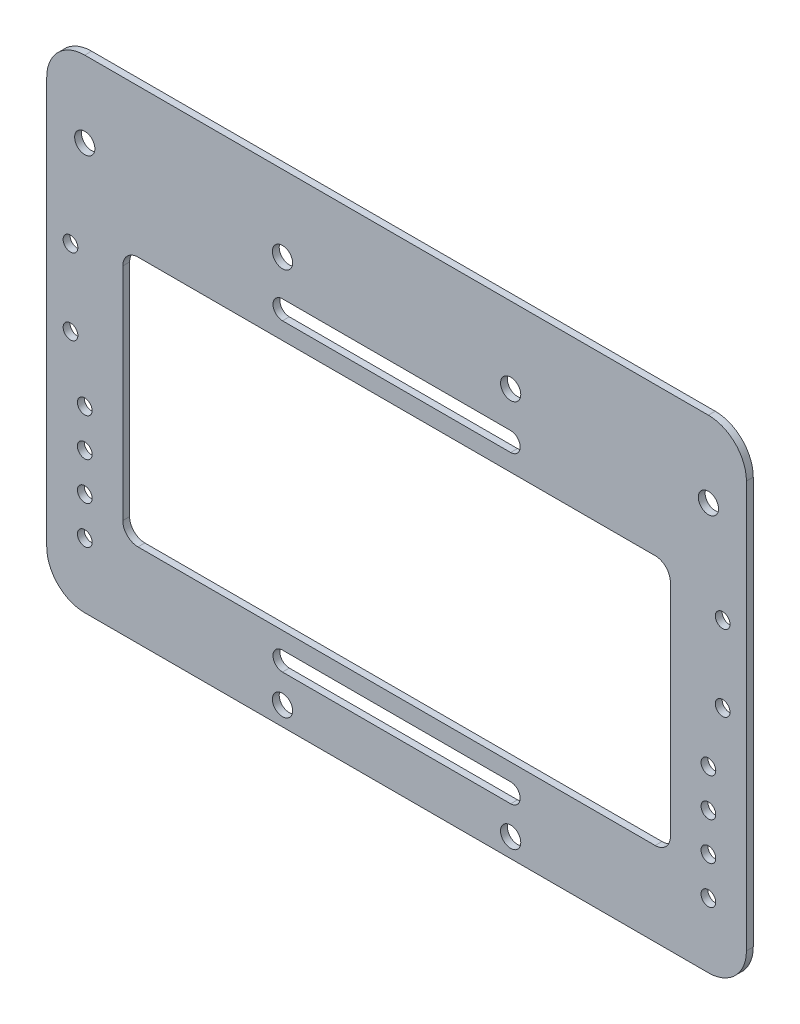
from build123d import *

# Parameters (mm, degrees)
SKETCH1_W                    = 233.68
SKETCH1_H                    = 161.29
BOSS_EXTRUDE1_DEPTH          = 2.286
CUT_EXTRUDE1_DEPTH           = 142.987419939
F_1_4_CLEARANCE_HOLE1_D      = 6.7564
F_1_4_CLEARANCE_HOLE2_D      = 6.7564
F_10_0_1935_DIAMETER_HOLE1_D = 4.9149
FILLET1_R                    = 12.7
F_10_0_1935_DIAMETER_HOLE2_D = 4.9149


with BuildPart() as part:
    # Sketch1 → Boss-Extrude1 (new body)
    with BuildSketch(Plane.XY):
        Rectangle(SKETCH1_W, SKETCH1_H)
        with BuildLine():
            Line((-86.36, 31.115), (86.36, 31.115))
            ThreePointArc((86.36, 31.115), (89.952102448, 29.627102448), (91.44, 26.035))
            Line((91.44, 26.035), (91.44, -47.625))
            ThreePointArc((91.44, -47.625), (89.952102448, -51.217102448), (86.36, -52.705))
            Line((86.36, -52.705), (-86.36, -52.705))
            ThreePointArc((-86.36, -52.705), (-89.952102448, -51.217102448), (-91.44, -47.625))
            Line((-91.44, -47.625), (-91.44, 26.035))
            ThreePointArc((-91.44, 26.035), (-89.952102448, 29.627102448), (-86.36, 31.115))
        make_face(mode=Mode.SUBTRACT)
    extrude(amount=BOSS_EXTRUDE1_DEPTH)

    # Sketch2 → Cut-Extrude1 (cut, through all)
    with BuildSketch(Plane.XY.offset(2.286)):
        with BuildLine():
            Line((38.1, 36.83), (-38.1, 36.83))
            ThreePointArc((-38.1, 36.83), (-41.275, 40.005), (-38.1, 43.18))
            Line((-38.1, 43.18), (38.1, 43.18))
            ThreePointArc((38.1, 43.18), (41.275, 40.005), (38.1, 36.83))
        make_face()
        with BuildLine():
            Line((38.1, -58.42), (-38.1, -58.42))
            ThreePointArc((-38.1, -58.42), (-41.275, -61.595), (-38.1, -64.77))
            Line((-38.1, -64.77), (38.1, -64.77))
            ThreePointArc((38.1, -64.77), (41.275, -61.595), (38.1, -58.42))
        make_face()
    extrude(amount=-CUT_EXTRUDE1_DEPTH, mode=Mode.SUBTRACT)

    # 1/4 Clearance Hole1 (through all)
    with Locations(Plane.XY.offset(2.286)):
        with Locations((-38.1, 55.245), (38.1, 55.245), (-38.1, -74.295), (38.1, -74.295)):
            Hole(F_1_4_CLEARANCE_HOLE1_D / 2)

    # 1/4 Clearance Hole2 (through all)
    with Locations(Plane.XY.offset(2.286)):
        with Locations((-104.14, 55.245), (104.14, 55.245)):
            Hole(F_1_4_CLEARANCE_HOLE2_D / 2)

    # #10 (0.1935) Diameter Hole1 (through all)
    with Locations(Plane.XY.offset(2.286)):
        with Locations((-108.9025, 23.749), (-108.9025, -1.651)):
            f_10_0_1935_diameter_hole1 = Hole(F_10_0_1935_DIAMETER_HOLE1_D / 2)

    # Mirror1: #10 (0.1935) Diameter Hole1 across plane
    add(f_10_0_1935_diameter_hole1.mirror(Plane(origin=(0, 0, 0), x_dir=(0, 0, 1), z_dir=(1, 0, 0))), mode=Mode.SUBTRACT)

    # Fillet1
    fillet1_edges = [part.edges().sort_by_distance(p)[0] for p in [
        (-116.84, 80.645, 1.143),
        (116.84, 80.645, 1.143),
        (-116.84, -80.645, 1.143),
        (116.84, -80.645, 1.143),
    ]]
    fillet(fillet1_edges, radius=FILLET1_R)

    # #10 (0.1935) Diameter Hole2 (through all)
    with Locations(Plane.XY.offset(2.286)):
        with Locations((-104.14, -20.955), (104.14, -20.955), (-104.14, -33.655), (104.14, -33.655), (-104.14, -46.355), (104.14, -46.355), (-104.14, -59.055), (104.14, -59.055)):
            Hole(F_10_0_1935_DIAMETER_HOLE2_D / 2)


solid = part.part
